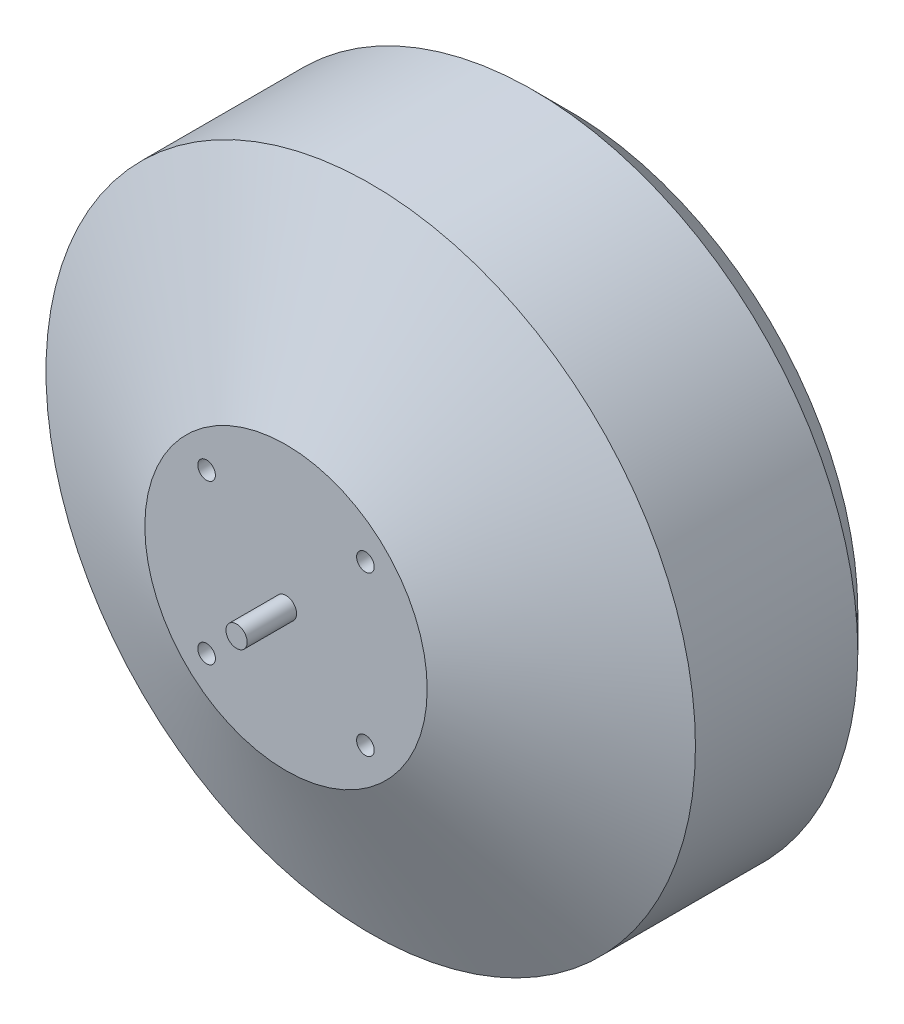
from build123d import *

# Parameters (mm, degrees)
SKETCH2_R          = 1.25
ROTOR_HOLES_DEPTH  = 10
SKETCH4_R          = 1.75
STATOR_HOLES_DEPTH = 10
SKETCH5_R          = 1.75
HOLE_DEPTH         = 5
FILLET1_R          = 1
SKETCH6_R          = 1.5
SHAFT_DEPTH        = 7
CHAMFER1_SIZE      = 5


with BuildPart() as part:
    # Sketch1 → Body (revolve)
    with BuildSketch(Plane(origin=(0, 0, 0), x_dir=(0, 0, -1), z_dir=(1, 0, 0))):
        Polygon((0, 46), (-28, 46), (-40, 20), (-40, 0), (0, 0), align=None)
    revolve(axis=Axis((0, 0, 1764.481038956), (0, 0, -1)))

    # Sketch2 → Rotor_Holes (cut)
    with BuildSketch(Plane.XY.offset(40)):
        with Locations((-11.25, 11.25)):
            Circle(SKETCH2_R)
        with Locations((11.25, 11.25)):
            Circle(SKETCH2_R)
        with Locations((11.25, -11.25)):
            Circle(SKETCH2_R)
        with Locations((-11.25, -11.25)):
            Circle(SKETCH2_R)
    extrude(amount=-ROTOR_HOLES_DEPTH, mode=Mode.SUBTRACT)

    # Sketch4 → Stator_Holes (cut)
    with BuildSketch(Plane(origin=(0, 0, 0), x_dir=(-1, 0, 0), z_dir=(0, 0, -1))):
        with Locations((-14.25, 14.25)):
            Circle(SKETCH4_R)
        with Locations((14.25, 14.25)):
            Circle(SKETCH4_R)
        with Locations((14.25, -14.25)):
            Circle(SKETCH4_R)
        with Locations((-14.25, -14.25)):
            Circle(SKETCH4_R)
    extrude(amount=-STATOR_HOLES_DEPTH, mode=Mode.SUBTRACT)

    # Sketch5 → Hole (cut)
    with BuildSketch(Plane(origin=(0, 0, 0), x_dir=(-1, 0, 0), z_dir=(0, 0, -1))):
        Circle(SKETCH5_R)
    extrude(amount=-HOLE_DEPTH, mode=Mode.SUBTRACT)

    # Fillet1
    fillet1_edges = [part.edges().sort_by_distance(p)[0] for p in [
        (1.75, 0, 0),
    ]]
    fillet(fillet1_edges, radius=FILLET1_R)

    # Sketch6 → Shaft (add)
    with BuildSketch(Plane.XY.offset(40)):
        Circle(SKETCH6_R)
    extrude(amount=SHAFT_DEPTH)

    # Chamfer1
    chamfer1_edges = [part.edges().sort_by_distance(p)[0] for p in [
        (0, -46, 0),
    ]]
    chamfer(chamfer1_edges, length=CHAMFER1_SIZE)


solid = part.part
